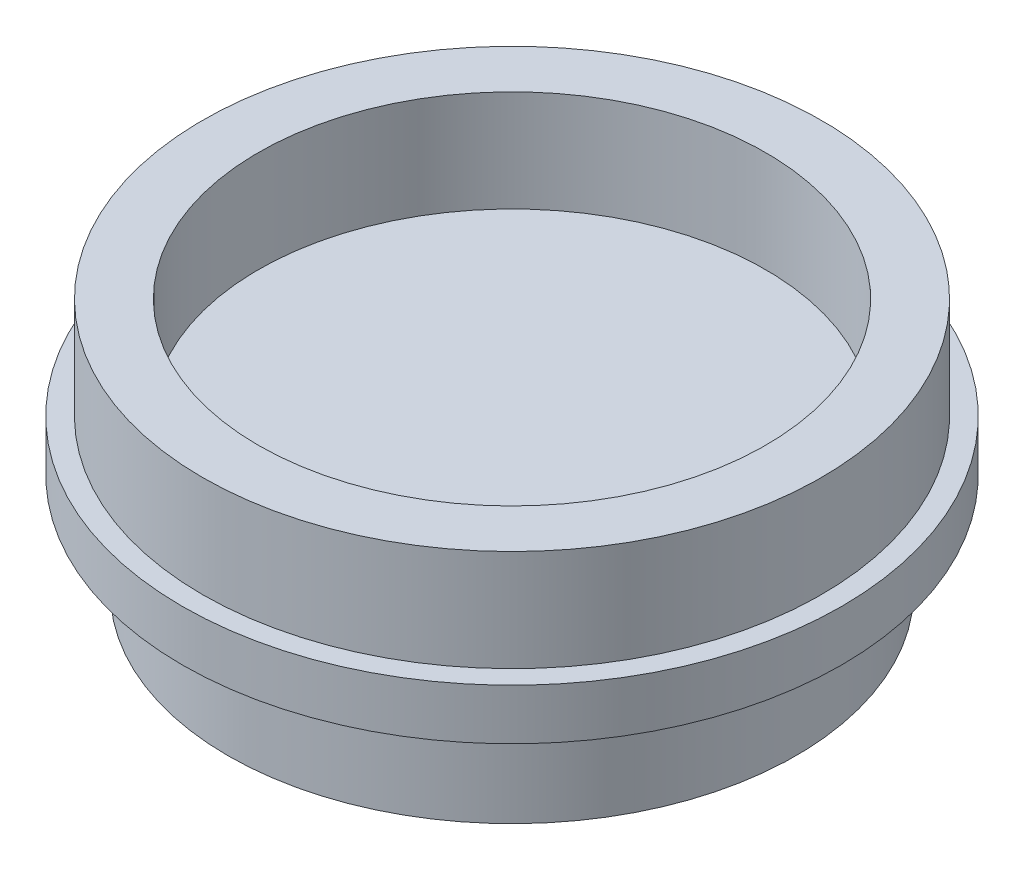
from build123d import *

# Parameters (mm, degrees)
SKETCH1_R           = 32.5
BOSS_EXTRUDE1_DEPTH = 5
SKETCH2_R           = 28
SKETCH2_R_2         = 22.5
BOSS_EXTRUDE2_DEPTH = 10
SKETCH3_R           = 30.5
SKETCH3_R_2         = 25
BOSS_EXTRUDE3_DEPTH = 10


with BuildPart() as part:
    # Sketch1 → Boss-Extrude1 (new body)
    with BuildSketch(Plane(origin=(0, 0, 0), x_dir=(1, 0, 0), z_dir=(0, 1, 0))):
        Circle(SKETCH1_R)
    extrude(amount=BOSS_EXTRUDE1_DEPTH)

    # Sketch2 → Boss-Extrude2 (add)
    with BuildSketch(Plane.XZ):
        Circle(SKETCH2_R)
        Circle(SKETCH2_R_2, mode=Mode.SUBTRACT)
    extrude(amount=BOSS_EXTRUDE2_DEPTH)

    # Sketch3 → Boss-Extrude3 (add)
    with BuildSketch(Plane(origin=(0, 5, 0), x_dir=(1, 0, 0), z_dir=(0, 1, 0))):
        Circle(SKETCH3_R)
        Circle(SKETCH3_R_2, mode=Mode.SUBTRACT)
    extrude(amount=BOSS_EXTRUDE3_DEPTH)


solid = part.part
